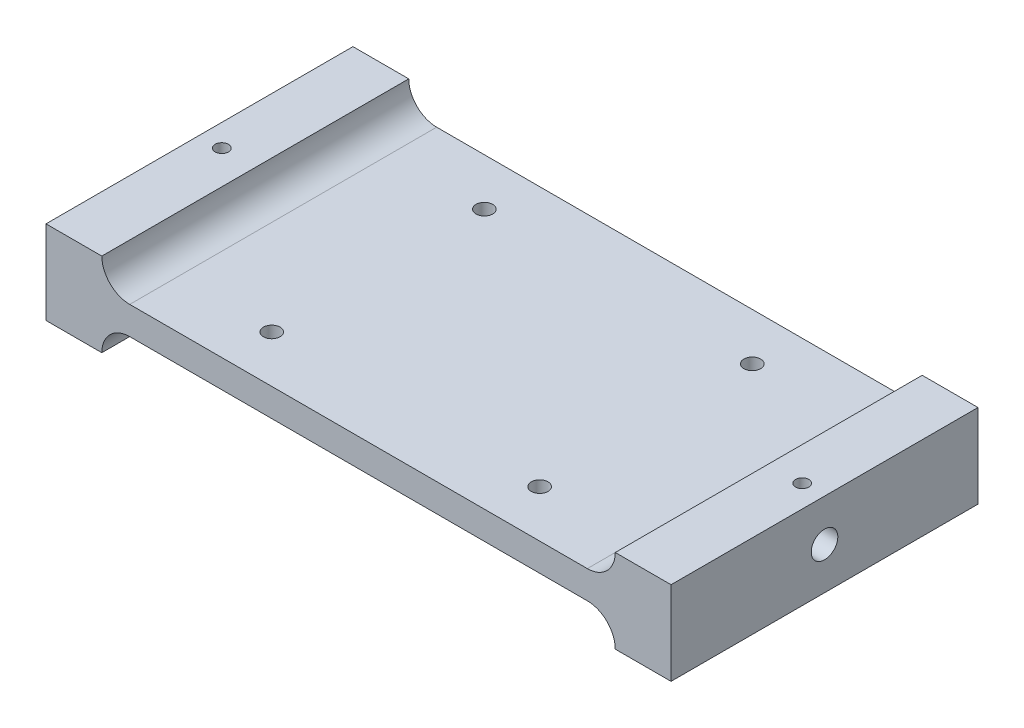
from build123d import *

# Parameters (mm, degrees)
SKETCH1_W           = 92
SKETCH1_H           = 55
SKETCH1_R           = 1.5
BOSS_EXTRUDE3_DEPTH = 2.5
SKETCH4_W           = 55
SKETCH4_H           = 15
BOSS_EXTRUDE4_DEPTH = 10
SKETCH5_W           = 55
SKETCH5_H           = 15
BOSS_EXTRUDE5_DEPTH = 10
SKETCH6_R           = 2.38125
CUT_EXTRUDE1_DEPTH  = 8
CUT_EXTRUDE2_REACH  = 66.166
SKETCH7_R           = 1.190625
CUT_EXTRUDE4_START  = -8
SKETCH8_R           = 2.38125
CUT_EXTRUDE4_DEPTH  = 8
FILLET1_R           = 5


with BuildPart() as part:
    # Sketch1 → Boss-Extrude3 (new, symmetric)
    with BuildSketch(Plane(origin=(0, 0, 0), x_dir=(1, 0, 0), z_dir=(0, 1, 0))):
        Rectangle(SKETCH1_W, SKETCH1_H)
        with Locations(Location((-24, 19.05, 0), (0, 0, 270))):
            Circle(SKETCH1_R, mode=Mode.SUBTRACT)
        with Locations(Location((24, 19.05, 0), (0, 0, 270))):
            Circle(SKETCH1_R, mode=Mode.SUBTRACT)
        with Locations(Location((-24, -19.05, 0), (0, 0, 270))):
            Circle(SKETCH1_R, mode=Mode.SUBTRACT)
        with Locations(Location((24, -19.05, 0), (0, 0, 270))):
            Circle(SKETCH1_R, mode=Mode.SUBTRACT)
    extrude(amount=BOSS_EXTRUDE3_DEPTH, both=True)

    # Sketch4 → Boss-Extrude4 (add)
    with BuildSketch(Plane(origin=(46, 0, 0), x_dir=(0, 0, -1), z_dir=(1, 0, 0))):
        Rectangle(SKETCH4_W, SKETCH4_H)
    extrude(amount=BOSS_EXTRUDE4_DEPTH)

    # Sketch5 → Boss-Extrude5 (add)
    with BuildSketch(Plane.ZY.offset(46)):
        Rectangle(SKETCH5_W, SKETCH5_H)
    extrude(amount=BOSS_EXTRUDE5_DEPTH)

    # Sketch6 → Cut-Extrude1 (cut)
    with BuildSketch(Plane(origin=(56, 0, 0), x_dir=(0, 0, -1), z_dir=(1, 0, 0))):
        Circle(SKETCH6_R)
    extrude(amount=-CUT_EXTRUDE1_DEPTH, mode=Mode.SUBTRACT)

    # Sketch7 → Cut-Extrude2 (cut, up to next)
    with BuildSketch(Plane(origin=(0, 7.5, 0), x_dir=(1, 0, 0), z_dir=(0, 1, 0)), mode=Mode.PRIVATE) as cut_extrude2_sk1:
        with Locations(Location((52, 0, 0), (0, 0, 270))):
            Circle(SKETCH7_R)
    cut_extrude2_tool1 = extrude(cut_extrude2_sk1.sketch, amount=-CUT_EXTRUDE2_REACH, mode=Mode.PRIVATE) & part.part
    # Sketch7 → Cut-Extrude2 (cut, up to next)
    with BuildSketch(Plane(origin=(0, 7.5, 0), x_dir=(1, 0, 0), z_dir=(0, 1, 0)), mode=Mode.PRIVATE) as cut_extrude2_sk2:
        with Locations(Location((-52, 0, 0), (0, 0, 270))):
            Circle(SKETCH7_R)
    cut_extrude2_tool2 = extrude(cut_extrude2_sk2.sketch, amount=-CUT_EXTRUDE2_REACH, mode=Mode.PRIVATE) & part.part
    add(cut_extrude2_tool1.solids().sort_by_distance((52, 7.5, 0))[0], mode=Mode.SUBTRACT)
    add(cut_extrude2_tool2.solids().sort_by_distance((-52, 7.5, 0))[0], mode=Mode.SUBTRACT)

    # Sketch8 → Cut-Extrude4 (cut)
    with BuildSketch(Plane.ZY.offset(56).offset(CUT_EXTRUDE4_START)):
        with Locations(Location((0, 0, 0), (0, 0, 180))):
            Circle(SKETCH8_R)
    extrude(amount=CUT_EXTRUDE4_DEPTH, mode=Mode.SUBTRACT)

    # Fillet1
    fillet1_edges = [part.edges().sort_by_distance(p)[0] for p in [
        (-46, -2.5, 0),
        (46, -2.5, 0),
        (46, 2.5, 0),
        (-46, 2.5, 0),
    ]]
    fillet(fillet1_edges, radius=FILLET1_R - 0.0001)  # a hair under: the kernel refuses the full size


solid = part.part
